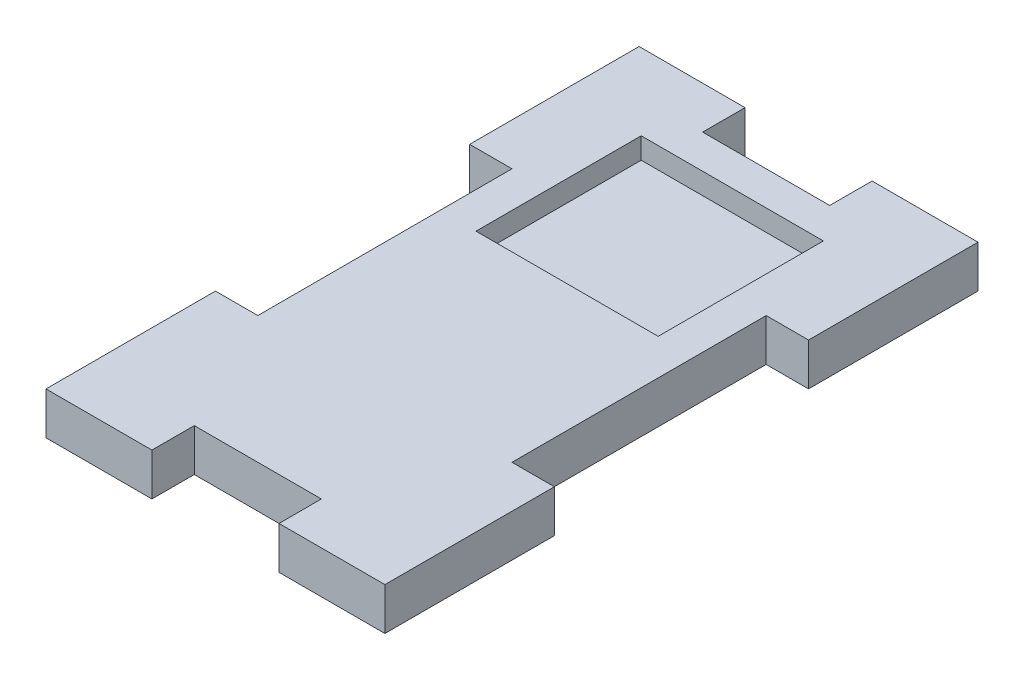
from build123d import *

# Parameters (mm, degrees)
SKETCH1_W               = 40
SKETCH1_H               = 70
BOSS_EXTRUDE1_DEPTH     = 5
CUT_EXTRUDE2_START      = -2.5
SKETCH4_W               = 21.5
SKETCH4_H               = 19.5
CUT_EXTRUDE2_DEPTH      = 2.5
CUT_EXTRUDE3_DEPTH      = 81.777472107
CUT_EXTRUDE3_DEPTH_BACK = 81.777472107
SKETCH5_W               = 5
SKETCH5_H               = 30
SKETCH5_W_2             = 15
SKETCH5_H_2             = 5


with BuildPart() as part:
    # Sketch1 → Boss-Extrude1 (new body)
    with BuildSketch(Plane(origin=(0, 0, 0), x_dir=(1, 0, 0), z_dir=(0, 1, 0))):
        with Locations((20, 35)):
            Rectangle(SKETCH1_W, SKETCH1_H)
    extrude(amount=BOSS_EXTRUDE1_DEPTH)

    # Sketch4 → Cut-Extrude2 (cut)
    with BuildSketch(Plane.XZ.offset(CUT_EXTRUDE2_START)):
        with Locations((20, -51.25)):
            Rectangle(SKETCH4_W, SKETCH4_H)
    extrude(amount=-CUT_EXTRUDE2_DEPTH, mode=Mode.SUBTRACT)

    # Sketch5 → Cut-Extrude3 (cut, two sides: drawn at the far end of the back side and taken through both)
    with BuildSketch(Plane(origin=(0, 5, 0), x_dir=(1, 0, 0), z_dir=(0, 1, 0)).offset(-CUT_EXTRUDE3_DEPTH_BACK)):
        with Locations((2.5, 35)):
            Rectangle(SKETCH5_W, SKETCH5_H)
        with Locations((20, 67.5)):
            Rectangle(SKETCH5_W_2, SKETCH5_H_2)
        with Locations((37.5, 35)):
            Rectangle(SKETCH5_W, SKETCH5_H)
        with Locations((20, 2.5)):
            Rectangle(SKETCH5_W_2, SKETCH5_H_2)
    extrude(amount=CUT_EXTRUDE3_DEPTH + CUT_EXTRUDE3_DEPTH_BACK, mode=Mode.SUBTRACT)


solid = part.part
